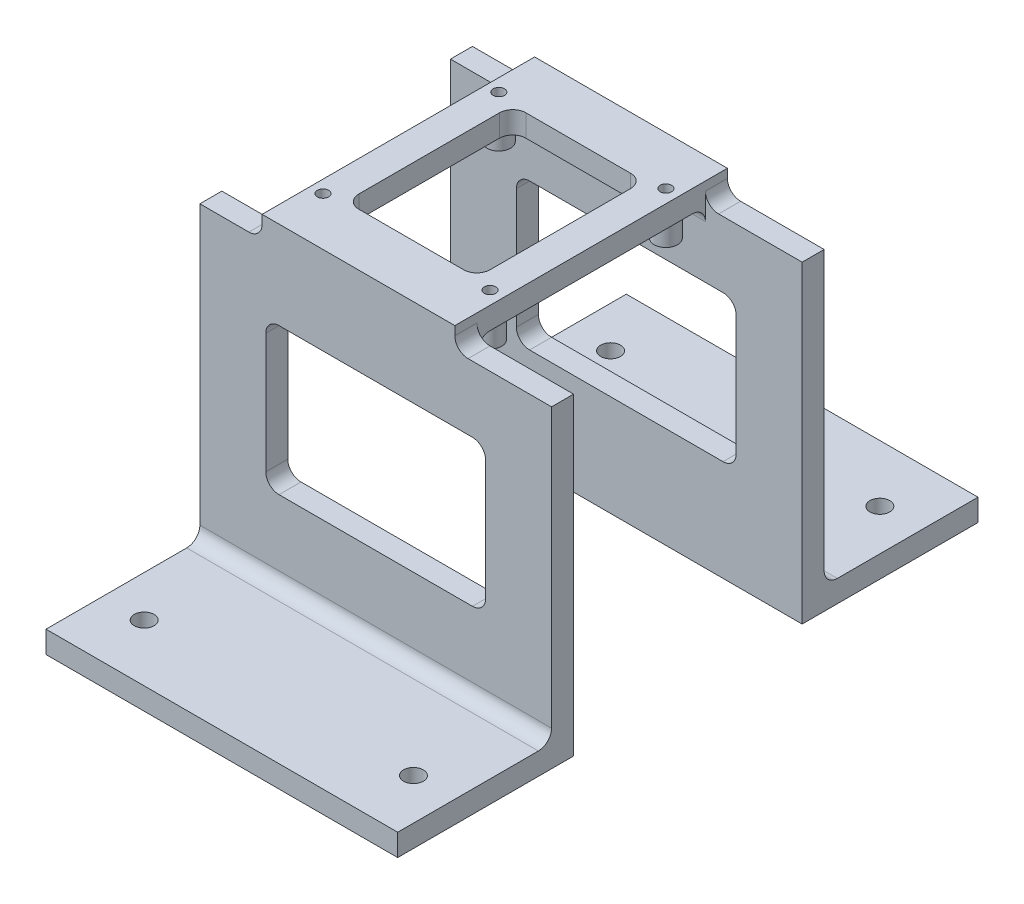
from build123d import *

# Parameters (mm, degrees)
SKETCH1_W               = 80
SKETCH1_H               = 40
SKETCH1_R               = 2.25
BOSS_EXTRUDE1_DEPTH     = 5
BOSS_EXTRUDE1_2_DEPTH   = 5
SKETCH2_W               = 80
SKETCH2_H               = 5
BOSS_EXTRUDE2_DEPTH     = 66.3
SKETCH3_W               = 43.85
SKETCH3_H               = 62
BOSS_EXTRUDE3_DEPTH     = 5
SKETCH5_W               = 29.85
SKETCH5_H               = 38
CUT_EXTRUDE2_DEPTH      = 10
CUT_EXTRUDE1_REACH      = 110.525
SKETCH4_R               = 1.3
FILLET1_R               = 3
FILLET2_R               = 3
CUT_EXTRUDE3_DEPTH      = 130.733149195
CUT_EXTRUDE3_DEPTH_BACK = 130.733149195
SKETCH6_W               = 50
SKETCH6_H               = 33.3
FILLET3_R               = 3
SKETCH9_R               = 2.65
SKETCH9_R_2             = 1.05
BOSS_EXTRUDE5_DEPTH     = 4.75


with BuildPart() as part:
    # Sketch1 → Boss-Extrude1 (new body)
    with BuildSketch(Plane(origin=(0, 0, 0), x_dir=(1, 0, 0), z_dir=(0, 1, 0))):
        with Locations((0, 46)):
            Rectangle(SKETCH1_W, SKETCH1_H)
        with Locations((-30.625, 53.044055982)):
            Circle(SKETCH1_R, mode=Mode.SUBTRACT)
        with Locations((30.625, 53.044055982)):
            Circle(SKETCH1_R, mode=Mode.SUBTRACT)
    extrude(amount=BOSS_EXTRUDE1_DEPTH)



with BuildPart() as body_2:
    # Sketch1 → Boss-Extrude1 2 (new body)
    with BuildSketch(Plane(origin=(0, 0, 0), x_dir=(1, 0, 0), z_dir=(0, 1, 0))):
        with Locations((0, -46)):
            Rectangle(SKETCH1_W, SKETCH1_H)
        with Locations((30.625, -53.044055982)):
            Circle(SKETCH1_R, mode=Mode.SUBTRACT)
        with Locations((-30.625, -53.044055982)):
            Circle(SKETCH1_R, mode=Mode.SUBTRACT)
    extrude(amount=BOSS_EXTRUDE1_2_DEPTH)


with BuildPart() as part_1:
    add(part.part)

    add(body_2.part)  # Boss-Extrude2 merges body 2
    # Sketch2 → Boss-Extrude2 (add)
    with BuildSketch(Plane(origin=(0, 5, 0), x_dir=(1, 0, 0), z_dir=(0, 1, 0))):
        with Locations((0, 28.5)):
            Rectangle(SKETCH2_W, SKETCH2_H)
        with Locations((0, -28.5)):
            Rectangle(SKETCH2_W, SKETCH2_H)
    extrude(amount=BOSS_EXTRUDE2_DEPTH)

    # Sketch3 → Boss-Extrude3 (add)
    with BuildSketch(Plane(origin=(0, 71.3, 0), x_dir=(1, 0, 0), z_dir=(0, 1, 0))):
        with Locations((-3.925, 0)):
            Rectangle(SKETCH3_W, SKETCH3_H)
    extrude(amount=BOSS_EXTRUDE3_DEPTH)

    # Sketch5 → Cut-Extrude2 (cut)
    with BuildSketch(Plane.XZ.offset(-71.3)):
        with Locations((-3.925, 0)):
            Rectangle(SKETCH5_W, SKETCH5_H)
    extrude(amount=-CUT_EXTRUDE2_DEPTH, mode=Mode.SUBTRACT)

    # Sketch4 → Cut-Extrude1 (cut, up to next)
    with BuildSketch(Plane(origin=(0, 76.3, 0), x_dir=(1, 0, 0), z_dir=(0, 1, 0)), mode=Mode.PRIVATE) as cut_extrude1_sk1:
        with Locations((-23, 20)):
            Circle(SKETCH4_R)
    cut_extrude1_tool1 = extrude(cut_extrude1_sk1.sketch, amount=-CUT_EXTRUDE1_REACH, mode=Mode.PRIVATE) & part_1.part
    # Sketch4 → Cut-Extrude1 (cut, up to next)
    with BuildSketch(Plane(origin=(0, 76.3, 0), x_dir=(1, 0, 0), z_dir=(0, 1, 0)), mode=Mode.PRIVATE) as cut_extrude1_sk2:
        with Locations((15, 20)):
            Circle(SKETCH4_R)
    cut_extrude1_tool2 = extrude(cut_extrude1_sk2.sketch, amount=-CUT_EXTRUDE1_REACH, mode=Mode.PRIVATE) & part_1.part
    # Sketch4 → Cut-Extrude1 (cut, up to next)
    with BuildSketch(Plane(origin=(0, 76.3, 0), x_dir=(1, 0, 0), z_dir=(0, 1, 0)), mode=Mode.PRIVATE) as cut_extrude1_sk3:
        with Locations((15, -20)):
            Circle(SKETCH4_R)
    cut_extrude1_tool3 = extrude(cut_extrude1_sk3.sketch, amount=-CUT_EXTRUDE1_REACH, mode=Mode.PRIVATE) & part_1.part
    # Sketch4 → Cut-Extrude1 (cut, up to next)
    with BuildSketch(Plane(origin=(0, 76.3, 0), x_dir=(1, 0, 0), z_dir=(0, 1, 0)), mode=Mode.PRIVATE) as cut_extrude1_sk4:
        with Locations((-23, -20)):
            Circle(SKETCH4_R)
    cut_extrude1_tool4 = extrude(cut_extrude1_sk4.sketch, amount=-CUT_EXTRUDE1_REACH, mode=Mode.PRIVATE) & part_1.part
    add(cut_extrude1_tool1.solids().sort_by_distance((-23, 76.3, -20))[0], mode=Mode.SUBTRACT)
    add(cut_extrude1_tool2.solids().sort_by_distance((15, 76.3, -20))[0], mode=Mode.SUBTRACT)
    add(cut_extrude1_tool3.solids().sort_by_distance((15, 76.3, 20))[0], mode=Mode.SUBTRACT)
    add(cut_extrude1_tool4.solids().sort_by_distance((-23, 76.3, 20))[0], mode=Mode.SUBTRACT)

    # Fillet1
    fillet1_edges = [part_1.edges().sort_by_distance(p)[0] for p in [
        (-3.925, 71.3, -26),
        (-3.925, 71.3, 26),
        (0, 5, -31),
        (0, 5, 31),
    ]]
    fillet(fillet1_edges, radius=FILLET1_R)

    # Fillet2
    fillet2_edges = [part_1.edges().sort_by_distance(p)[0] for p in [
        (18, 71.3, -28.5),
        (-25.85, 71.3, -28.5),
        (-25.85, 71.3, 28.5),
        (18, 71.3, 28.5),
    ]]
    fillet(fillet2_edges, radius=FILLET2_R)

    # Sketch6 → Cut-Extrude3 (cut, two sides: drawn at the far end of the back side and taken through both)
    with BuildSketch(Plane.XY.offset(31).offset(-CUT_EXTRUDE3_DEPTH_BACK)):
        with Locations((0, 39.65)):
            Rectangle(SKETCH6_W, SKETCH6_H)
    extrude(amount=CUT_EXTRUDE3_DEPTH + CUT_EXTRUDE3_DEPTH_BACK, mode=Mode.SUBTRACT)

    # Fillet3
    fillet3_edges = [part_1.edges().sort_by_distance(p)[0] for p in [
        (-25, 56.3, -28.5),
        (25, 56.3, -28.5),
        (25, 23, -28.5),
        (-25, 23, -28.5),
        (-25, 56.3, 28.5),
        (25, 56.3, 28.5),
        (25, 23, 28.5),
        (-25, 23, 28.5),
        (-18.85, 73.8, -19),
        (-18.85, 73.8, 19),
        (11, 73.8, 19),
        (11, 73.8, -19),
    ]]
    fillet(fillet3_edges, radius=FILLET3_R)

    # Sketch9 → Boss-Extrude5 (add)
    # profile 1 of 4: a face of its own
    with BuildSketch(Plane.XZ.offset(-71.3)):
        with Locations((-23, 20)):
            Circle(SKETCH9_R)
        with Locations((-23, 20)):
            Circle(SKETCH9_R_2, mode=Mode.SUBTRACT)
    # profile 2 of 4: a face of its own
    with BuildSketch(Plane.XZ.offset(-71.3)):
        with Locations((-23, -20)):
            Circle(SKETCH9_R)
        with Locations((-23, -20)):
            Circle(SKETCH9_R_2, mode=Mode.SUBTRACT)
    # profile 3 of 4: a face of its own
    with BuildSketch(Plane.XZ.offset(-71.3)):
        with Locations((15, 20)):
            Circle(SKETCH9_R)
        with Locations((15, 20)):
            Circle(SKETCH9_R_2, mode=Mode.SUBTRACT)
    # profile 4 of 4: a face of its own
    with BuildSketch(Plane.XZ.offset(-71.3)):
        with Locations((15, -20)):
            Circle(SKETCH9_R)
        with Locations((15, -20)):
            Circle(SKETCH9_R_2, mode=Mode.SUBTRACT)
    extrude(amount=BOSS_EXTRUDE5_DEPTH)


solid = part_1.part
